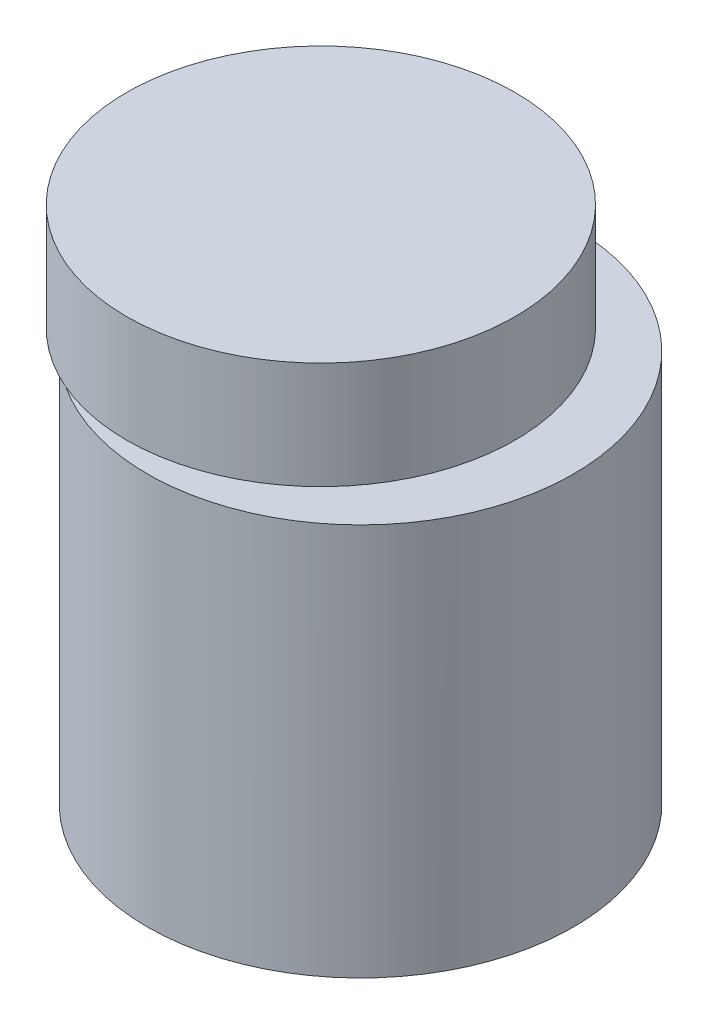
from build123d import *

# Parameters (mm, degrees)
SKIZZE1_R                       = 5.375
AUFSATZ_LINEAR_AUSTRAGEN1_DEPTH = 10
SKIZZE3_R                       = 5.4
AUFSATZ_LINEAR_AUSTRAGEN3_DEPTH = 10
SKIZZE5_R                       = 5.4
AUFSATZ_LINEAR_AUSTRAGEN4_DEPTH = 7.9
SKIZZE6_R                       = 4.9
AUFSATZ_LINEAR_AUSTRAGEN5_DEPTH = 2.7
SKIZZE8_R                       = 2.6
SCHNITT_LINEAR_AUSTRAGEN1_DEPTH = 25
SKIZZE9_W                       = 0.55
SKIZZE9_H                       = 3.199050193
AUFSATZ_LINEAR_AUSTRAGEN6_DEPTH = 15
SKIZZE10_W                      = 20.815127067
SKIZZE10_H                      = 15.6113453
SCHNITT_LINEAR_AUSTRAGEN2_DEPTH = 18


with BuildPart() as part:
    # Skizze1 → Aufsatz-Linear austragen1 (new body)
    with BuildSketch(Plane(origin=(0, 0, 0), x_dir=(1, 0, 0), z_dir=(0, 1, 0))):
        Circle(SKIZZE1_R)
    extrude(amount=AUFSATZ_LINEAR_AUSTRAGEN1_DEPTH)

    # Skizze3 → Aufsatz-Linear austragen3 (add)
    with BuildSketch(Plane(origin=(0, 0, 0), x_dir=(-1, 0, 0), z_dir=(0, -1, 0))):
        with Locations((2, 0)):
            Circle(SKIZZE3_R)
    extrude(amount=AUFSATZ_LINEAR_AUSTRAGEN3_DEPTH)

    # Skizze5 → Aufsatz-Linear austragen4 (add)
    with BuildSketch(Plane.XZ.offset(10)):
        with Locations((-1, 0)):
            Circle(SKIZZE5_R)
    extrude(amount=AUFSATZ_LINEAR_AUSTRAGEN4_DEPTH)

    # Skizze6 → Aufsatz-Linear austragen5 (add)
    with BuildSketch(Plane(origin=(0, 10, 0), x_dir=(1, 0, 0), z_dir=(0, 1, 0))):
        with Locations((-1, 0)):
            Circle(SKIZZE6_R)
    extrude(amount=AUFSATZ_LINEAR_AUSTRAGEN5_DEPTH)

    # Skizze8 → Schnitt-Linear austragen1 (cut)
    with BuildSketch(Plane.XZ.offset(17.9)):
        with Locations((-1, 0)):
            Circle(SKIZZE8_R)
    extrude(amount=-SCHNITT_LINEAR_AUSTRAGEN1_DEPTH, mode=Mode.SUBTRACT)

    # Skizze9 → Aufsatz-Linear austragen6 (add)
    with BuildSketch(Plane(origin=(0, 7.1, 0), x_dir=(-1, 0, 0), z_dir=(0, -1, 0))):
        with Locations((-1.325, 0.000306537)):
            Rectangle(SKIZZE9_W, SKIZZE9_H)
    extrude(amount=AUFSATZ_LINEAR_AUSTRAGEN6_DEPTH)

    # Skizze10 → Schnitt-Linear austragen2 (cut)
    with BuildSketch(Plane.XZ.offset(17.9)):
        with Locations((-0.021672287, -0.065047272)):
            Rectangle(SKIZZE10_W, SKIZZE10_H)
    extrude(amount=-SCHNITT_LINEAR_AUSTRAGEN2_DEPTH, mode=Mode.SUBTRACT)


solid = part.part
